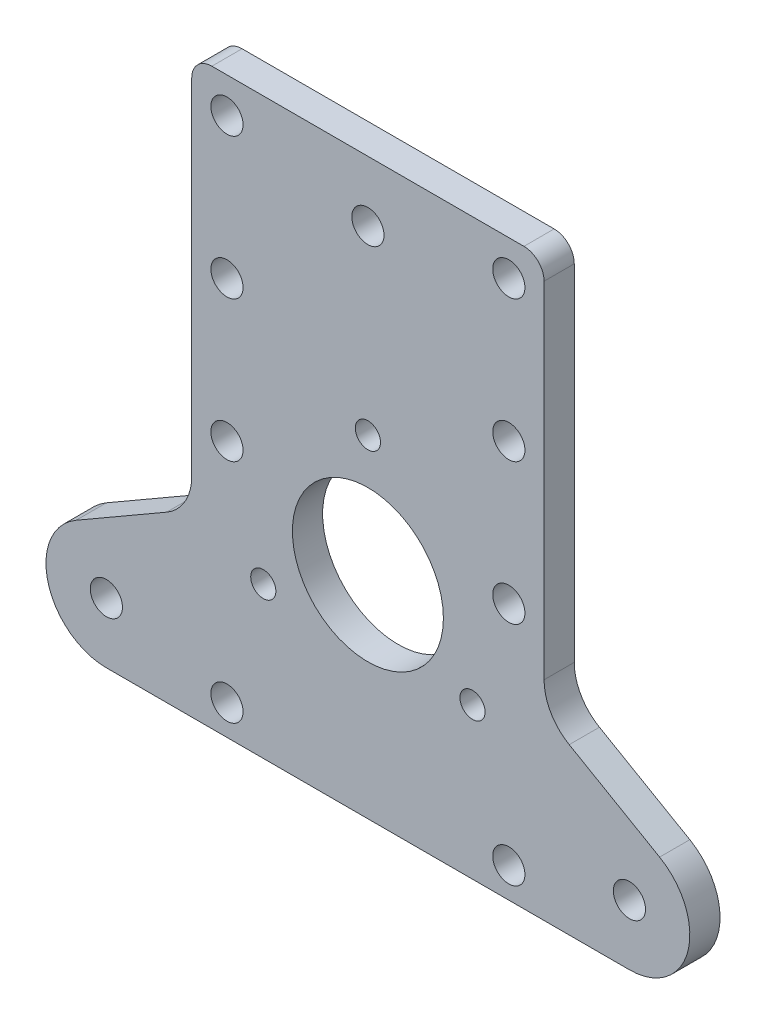
from build123d import *

# Parameters (mm, degrees)
CHAMFER1_SIZE                  = 1
CHAMFER1_SIZE2                 = 2.747477419
CIRPATTERN2_COUNT              = 3
BOSS_EXTRUDE1_DEPTH            = 3
SKETCH4_R                      = 7.5
CUT_EXTRUDE1_DEPTH             = 49.603797643
SKETCH6_W                      = 1.25
SKETCH6_H                      = 3
M3X0_5_TAPPED_HOLE2_AT_2_COUNT = 2
M3X0_5_TAPPED_HOLE2_AT_2_PITCH = 20.784609691
M3X0_5_TAPPED_HOLE2_AT_3_COUNT = 2
M3X0_5_TAPPED_HOLE2_AT_3_PITCH = 20.784609691
FILLET1_R                      = 5
FILLET2_R                      = 2
SKETCH9_W                      = 1.6
SKETCH9_H                      = 6.6
M3_CLEARANCE_HOLE3_AT_2_COUNT  = 2
M3_CLEARANCE_HOLE3_AT_2_PITCH  = 14
M3_CLEARANCE_HOLE3_AT_3_COUNT  = 2
M3_CLEARANCE_HOLE3_AT_3_PITCH  = 28
M3_CLEARANCE_HOLE3_AT_4_COUNT  = 2
M3_CLEARANCE_HOLE3_AT_4_PITCH  = 50.5
M3_CLEARANCE_HOLE3_AT_5_COUNT  = 2
M3_CLEARANCE_HOLE3_AT_5_PITCH  = 57.742964939
M3_CLEARANCE_HOLE3_AT_6_COUNT  = 2
M3_CLEARANCE_HOLE3_AT_6_PITCH  = 39.597979746
M3_CLEARANCE_HOLE3_AT_7_COUNT  = 2
M3_CLEARANCE_HOLE3_AT_7_PITCH  = 31.304951685
M3_CLEARANCE_HOLE3_AT_8_COUNT  = 2
M3_CLEARANCE_HOLE3_AT_8_PITCH  = 28
SKETCH13_W                     = 1.6
SKETCH13_H                     = 6.6
M3_CLEARANCE_HOLE2_AT_2_COUNT  = 2
M3_CLEARANCE_HOLE2_AT_2_PITCH  = 51.961524227
M3_CLEARANCE_HOLE2_AT_3_COUNT  = 2
M3_CLEARANCE_HOLE2_AT_3_PITCH  = 51.961524227
CHAMFER2_SIZE                  = 0.4
CHAMFER3_SIZE                  = 0.4
CHAMFER4_SIZE                  = 0.4


with BuildPart() as part:
    # Sketch3 → Revolve1 (revolve)
    with BuildSketch(Plane(origin=(0, 0, 0), x_dir=(0, 0, -1), z_dir=(1, 0, 0)), mode=Mode.PRIVATE) as revolve1_sk:
        with BuildLine():
            Line((0, 31.6), (0.233939444, 31.6))
            ThreePointArc((0.233939444, 31.6), (1.585065492, 33.262066557), (3.6, 33.988734135))
            Line((3.6, 33.988734135), (3.6, 35.988734135))
            Line((3.6, 35.988734135), (0, 35.988734135))
            Line((0, 35.988734135), (0, 31.6))
        make_face()
    revolve(revolve1_sk.sketch.rotate(Axis((0, 30, 0), (0, 0, -1)), 90), axis=Axis((0, 30, 0), (0, 0, -1)))

    # Chamfer1
    chamfer1_edges = [part.edges().sort_by_distance(p)[0] for p in [
        (-5.988734135, 30, -3.6),
    ]]
    chamfer1_side = [part.faces().sort_by_distance(p)[0] for p in [
        (-4.158121116, 30, -3.6),
    ]]
    chamfer(chamfer1_edges, length=CHAMFER1_SIZE, length2=CHAMFER1_SIZE2, reference=chamfer1_side[0])


with BuildPart() as cirpattern2_1:
    # CirPattern2: pattern copy
    add(part.part.rotate(Axis((0, 0, 0), (0, 0, 1)), 1 * 360 / CIRPATTERN2_COUNT))

    # Chamfer4
    # the kernel refuses this chamfer: 0.4 mm, written as the material it takes off along each edge
    with BuildSketch(Plane(origin=(-25.980762114, -15, 0), x_dir=(-0.5000000000000001, 0.8660254037844387, 0), z_dir=(-0.8660254037844387, -0.5000000000000001, 0))) as chamfer4_piece_1:
        Polygon((5.988734135, CHAMFER4_SIZE), (5.988734135 - CHAMFER4_SIZE, 0), (5.988734135, 0), align=None)
    revolve(axis=Axis((-25.980762114, -15, 0), (0, 0, -1)), mode=Mode.SUBTRACT)
    with BuildSketch(Plane(origin=(-25.980762114, -15, 0), x_dir=(-0.4999999999999992, 0.866025403784439, 0), z_dir=(-0.866025403784439, -0.4999999999999992, 0))) as chamfer4_piece_2:
        Polygon((1.6, CHAMFER4_SIZE), (1.6 + CHAMFER4_SIZE, 0), (1.6, 0), align=None)
    revolve(axis=Axis((-25.980762114, -15, 0), (0, 0, -1)), mode=Mode.SUBTRACT)


with BuildPart() as cirpattern2_2:
    # CirPattern2: pattern copy
    add(part.part.rotate(Axis((0, 0, 0), (0, 0, 1)), 2 * 360 / CIRPATTERN2_COUNT))

    # Chamfer2
    # the kernel refuses this chamfer: 0.4 mm, written as the material it takes off along each edge
    with BuildSketch(Plane(origin=(25.980762114, -15, 0), x_dir=(-0.5000000000000006, -0.8660254037844384, 0), z_dir=(0.8660254037844384, -0.5000000000000006, 0))) as chamfer2_piece_1:
        Polygon((5.988734135, CHAMFER2_SIZE), (5.988734135 - CHAMFER2_SIZE, 0), (5.988734135, 0), align=None)
    revolve(axis=Axis((25.980762114, -15, 0), (0, 0, -1)), mode=Mode.SUBTRACT)
    with BuildSketch(Plane(origin=(25.980762114, -15, 0), x_dir=(-0.5000000000000004, -0.8660254037844384, 0), z_dir=(0.8660254037844384, -0.5000000000000004, 0))) as chamfer2_piece_2:
        Polygon((1.6, CHAMFER2_SIZE), (1.6 + CHAMFER2_SIZE, 0), (1.6, 0), align=None)
    revolve(axis=Axis((25.980762114, -15, 0), (0, 0, -1)), mode=Mode.SUBTRACT)


with BuildPart() as body_4:
    # Sketch1 → Boss-Extrude1 (new body)
    with BuildSketch(Plane.XY):
        with BuildLine():
            Line((25.980762114, -21), (-25.980762114, -21))
            ThreePointArc((-25.980762114, -21), (-31.776317071, -16.552914271), (-28.980762114, -9.803847577))
            Line((-28.980762114, -9.803847577), (-17.5, -3.175426481))
            Line((-17.5, -3.175426481), (-17.5, 36))
            Line((-17.5, 36), (17.5, 36))
            Line((17.5, 36), (17.5, -3.175426481))
            Line((17.5, -3.175426481), (28.980762114, -9.803847577))
            ThreePointArc((28.980762114, -9.803847577), (31.776317071, -16.552914271), (25.980762114, -21))
        make_face()
    extrude(amount=BOSS_EXTRUDE1_DEPTH)

    # Sketch4 → Cut-Extrude1 (cut, through all)
    with BuildSketch(Plane.XY.offset(3)):
        Circle(SKETCH4_R)
    extrude(amount=-CUT_EXTRUDE1_DEPTH, mode=Mode.SUBTRACT)

    # Sketch6 → M3x0.5 Tapped Hole2 (revolve, cut)
    with BuildSketch(Plane(origin=(-10.392304845, -6, 0), x_dir=(0, 1, 0), z_dir=(1, 0, 0))):
        with Locations((0.625, 1.5)):
            Rectangle(SKETCH6_W, SKETCH6_H)
    m3x0_5_tapped_hole2 = revolve(axis=Axis((-10.392304845, -6, -6.35), (0, 0, 1)), mode=Mode.SUBTRACT)

    # M3x0.5 Tapped Hole2 at 2: M3x0.5 Tapped Hole2 ×2
    with Locations(*[Vector(0.49999999999999795, 0.8660254037844399, 0) * (i * M3X0_5_TAPPED_HOLE2_AT_2_PITCH) for i in range(1, M3X0_5_TAPPED_HOLE2_AT_2_COUNT)]):
        add(m3x0_5_tapped_hole2, mode=Mode.SUBTRACT)

    # M3x0.5 Tapped Hole2 at 3: M3x0.5 Tapped Hole2 ×2
    with Locations(*[(i * M3X0_5_TAPPED_HOLE2_AT_3_PITCH, 0, 0) for i in range(1, M3X0_5_TAPPED_HOLE2_AT_3_COUNT)]):
        add(m3x0_5_tapped_hole2, mode=Mode.SUBTRACT)

    # Fillet1
    fillet1_edges = [body_4.edges().sort_by_distance(p)[0] for p in [
        (-17.5, -3.175426481, 1.5),
        (17.5, -3.175426481, 1.5),
    ]]
    fillet(fillet1_edges, radius=FILLET1_R)

    # Fillet2
    fillet2_edges = [body_4.edges().sort_by_distance(p)[0] for p in [
        (-17.5, 36, 1.5),
        (17.5, 36, 1.5),
    ]]
    fillet(fillet2_edges, radius=FILLET2_R)

    # Sketch9 → M3 Clearance Hole3 (revolve, cut)
    with BuildSketch(Plane(origin=(14, 32.5, 3), x_dir=(0, -1, 0), z_dir=(1, 0, 0))):
        with Locations((0.8, 3.3)):
            Rectangle(SKETCH9_W, SKETCH9_H)
    m3_clearance_hole3 = revolve(axis=Axis((14, 32.5, 9.35), (0, 0, -1)), mode=Mode.SUBTRACT)

    # M3 Clearance Hole3 at 2: M3 Clearance Hole3 ×2
    with Locations(*[(0, -i * M3_CLEARANCE_HOLE3_AT_2_PITCH, 0) for i in range(1, M3_CLEARANCE_HOLE3_AT_2_COUNT)]):
        add(m3_clearance_hole3, mode=Mode.SUBTRACT)

    # M3 Clearance Hole3 at 3: M3 Clearance Hole3 ×2
    with Locations(*[(0, -i * M3_CLEARANCE_HOLE3_AT_3_PITCH, 0) for i in range(1, M3_CLEARANCE_HOLE3_AT_3_COUNT)]):
        add(m3_clearance_hole3, mode=Mode.SUBTRACT)

    # M3 Clearance Hole3 at 4: M3 Clearance Hole3 ×2
    with Locations(*[(0, -i * M3_CLEARANCE_HOLE3_AT_4_PITCH, 0) for i in range(1, M3_CLEARANCE_HOLE3_AT_4_COUNT)]):
        add(m3_clearance_hole3, mode=Mode.SUBTRACT)

    # M3 Clearance Hole3 at 5: M3 Clearance Hole3 ×2
    with Locations(*[Vector(-0.48490755591360857, -0.8745654133441881, 0) * (i * M3_CLEARANCE_HOLE3_AT_5_PITCH) for i in range(1, M3_CLEARANCE_HOLE3_AT_5_COUNT)]):
        add(m3_clearance_hole3, mode=Mode.SUBTRACT)

    # M3 Clearance Hole3 at 6: M3 Clearance Hole3 ×2
    with Locations(*[Vector(-0.7071067811865479, -0.7071067811865472, 0) * (i * M3_CLEARANCE_HOLE3_AT_6_PITCH) for i in range(1, M3_CLEARANCE_HOLE3_AT_6_COUNT)]):
        add(m3_clearance_hole3, mode=Mode.SUBTRACT)

    # M3 Clearance Hole3 at 7: M3 Clearance Hole3 ×2
    with Locations(*[Vector(-0.8944271909999161, -0.4472135954999577, 0) * (i * M3_CLEARANCE_HOLE3_AT_7_PITCH) for i in range(1, M3_CLEARANCE_HOLE3_AT_7_COUNT)]):
        add(m3_clearance_hole3, mode=Mode.SUBTRACT)

    # M3 Clearance Hole3 at 8: M3 Clearance Hole3 ×2
    with Locations(*[(-i * M3_CLEARANCE_HOLE3_AT_8_PITCH, 0, 0) for i in range(1, M3_CLEARANCE_HOLE3_AT_8_COUNT)]):
        add(m3_clearance_hole3, mode=Mode.SUBTRACT)

    # Sketch13 → M3 Clearance Hole2 (revolve, cut)
    with BuildSketch(Plane(origin=(0, 30, 3), x_dir=(0, -1, 0), z_dir=(1, 0, 0))):
        with Locations((0.8, 3.3)):
            Rectangle(SKETCH13_W, SKETCH13_H)
    m3_clearance_hole2 = revolve(axis=Axis((0, 30, 9.35), (0, 0, -1)), mode=Mode.SUBTRACT)

    # M3 Clearance Hole2 at 2: M3 Clearance Hole2 ×2
    with Locations(*[Vector(0.49999999999999795, -0.8660254037844398, 0) * (i * M3_CLEARANCE_HOLE2_AT_2_PITCH) for i in range(1, M3_CLEARANCE_HOLE2_AT_2_COUNT)]):
        add(m3_clearance_hole2, mode=Mode.SUBTRACT)

    # M3 Clearance Hole2 at 3: M3 Clearance Hole2 ×2
    with Locations(*[Vector(-0.49999999999999784, -0.8660254037844399, 0) * (i * M3_CLEARANCE_HOLE2_AT_3_PITCH) for i in range(1, M3_CLEARANCE_HOLE2_AT_3_COUNT)]):
        add(m3_clearance_hole2, mode=Mode.SUBTRACT)


with BuildPart() as part_1:
    add(part.part)

    # Chamfer3
    # the kernel refuses this chamfer: 0.4 mm, written as the material it takes off along each edge
    with BuildSketch(Plane(origin=(0, 30, 0), x_dir=(1, 0, 0), z_dir=(0, 1, 0))) as chamfer3_piece_1:
        Polygon((5.988734135, CHAMFER3_SIZE), (5.988734135 - CHAMFER3_SIZE, 0), (5.988734135, 0), align=None)
    revolve(axis=Axis((0, 30, 0), (0, 0, -1)), mode=Mode.SUBTRACT)
    with BuildSketch(Plane(origin=(0, 30, 0), x_dir=(1, 0, 0), z_dir=(0, 1, 0))) as chamfer3_piece_2:
        Polygon((1.6, CHAMFER3_SIZE), (1.6 + CHAMFER3_SIZE, 0), (1.6, 0), align=None)
    revolve(axis=Axis((0, 30, 0), (0, 0, -1)), mode=Mode.SUBTRACT)


solid = body_4.part
